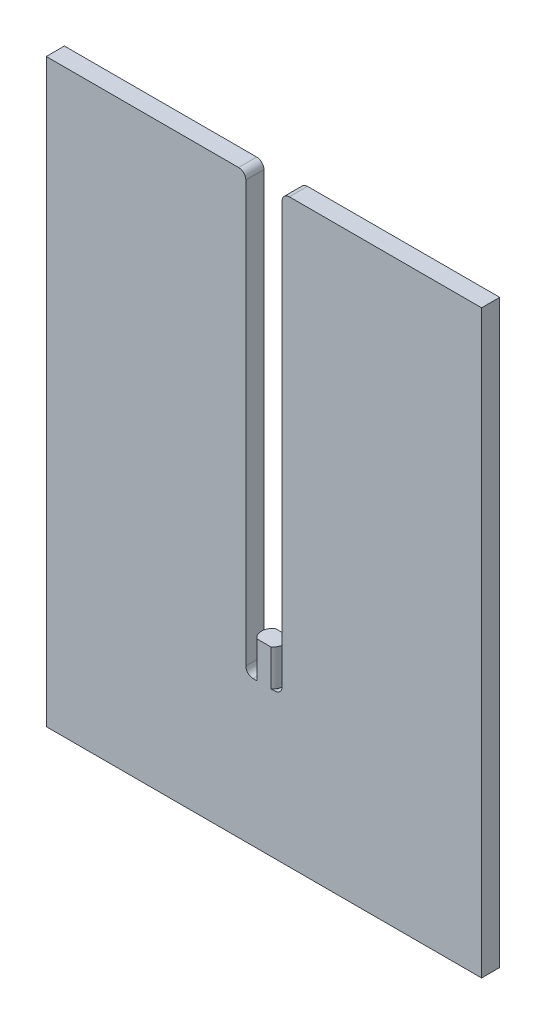
from build123d import *

# Parameters (mm, degrees)
BOSS_EXTRUDE1_DEPTH = 2.5
FILLET1_R           = 1
BOSS_EXTRUDE2_DEPTH = 5


with BuildPart() as part:
    # Sketch1 → Boss-Extrude1 (new body)
    with BuildSketch(Plane.XY):
        Polygon((-2.5, 40), (-2.5, -20), (2.5, -20), (2.5, 40), (30, 40), (30, -40), (-30, -40), (-30, 40), align=None)
    extrude(amount=BOSS_EXTRUDE1_DEPTH)

    # Fillet1
    fillet1_edges = [part.edges().sort_by_distance(p)[0] for p in [
        (-2.5, -20, 1.25),
        (2.5, -20, 1.25),
        (-2.5, 40, 1.25),
        (2.5, 40, 1.25),
    ]]
    fillet(fillet1_edges, radius=FILLET1_R)

    # Sketch2 → Boss-Extrude2 (add)
    with BuildSketch(Plane(origin=(0, -20, 0), x_dir=(1, 0, 0), z_dir=(0, 1, 0))):
        with BuildLine():
            Line((-0.957859614, 0), (0.957859614, 0))
            ThreePointArc((0.957859614, 0), (1.5748, -1.25), (0.957859614, -2.5))
            Line((0.957859614, -2.5), (-0.957859614, -2.5))
            ThreePointArc((-0.957859614, -2.5), (-1.5748, -1.25), (-0.957859614, 0))
        make_face()
    extrude(amount=BOSS_EXTRUDE2_DEPTH)


solid = part.part
